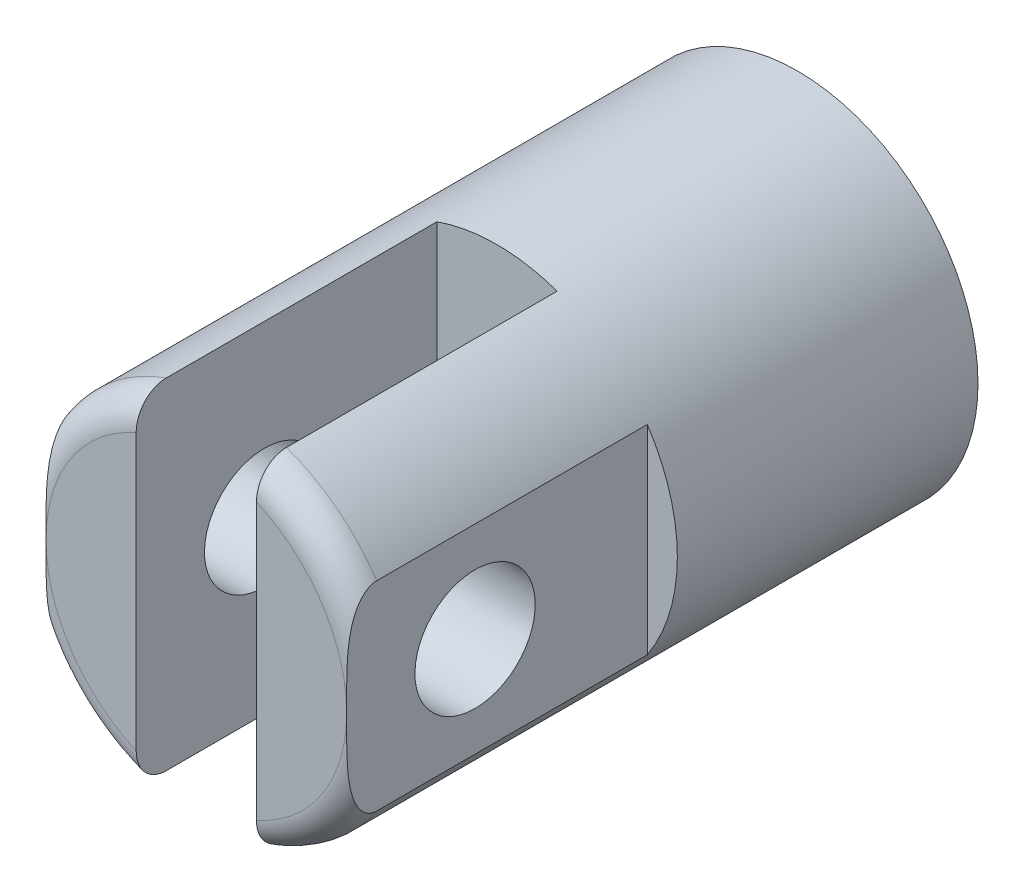
from build123d import *

# Parameters (mm, degrees)
SKETCH_1_R          = 6
SKETCH_1_R_2        = 2
EXTRUDE_1_DEPTH     = 10
EXTRUDE_2_DEPTH     = 10
SKETCH_3_R          = 2
CUT_EXTRUDE_3_DEPTH = 24.600847442
FILLET_1_R          = 1


with BuildPart() as part:
    # Эскиз1 → Вытянуть1 (new body)
    with BuildSketch(Plane.XY):
        Circle(SKETCH_1_R)
        Circle(SKETCH_1_R_2, mode=Mode.SUBTRACT)
    extrude(amount=EXTRUDE_1_DEPTH)

    # Эскиз2 → Вытянуть2 (add)
    with BuildSketch(Plane.XY.offset(10)):
        with BuildLine():
            Line((-5, 3.31662479), (-5, -3.31662479))
            ThreePointArc((-5, -3.31662479), (-3.69041576, -4.730838353), (-2, -5.656854249))
            Line((-2, -5.656854249), (-2, 5.656854249))
            ThreePointArc((-2, 5.656854249), (-3.69041576, 4.730838353), (-5, 3.31662479))
        make_face()
        with BuildLine():
            Line((2, 5.656854249), (2, -5.656854249))
            ThreePointArc((2, -5.656854249), (3.69041576, -4.730838353), (5, -3.31662479))
            Line((5, -3.31662479), (5, 3.31662479))
            ThreePointArc((5, 3.31662479), (3.69041576, 4.730838353), (2, 5.656854249))
        make_face()
    extrude(amount=EXTRUDE_2_DEPTH)

    # Эскиз3 → Вытянуть3 (cut, through all)
    with BuildSketch(Plane.ZY.offset(5)):
        with Locations(Location((15.728074635, 0, 0), (0, 0, 270))):
            Circle(SKETCH_3_R)
    extrude(amount=-CUT_EXTRUDE_3_DEPTH, mode=Mode.SUBTRACT)

    # Скругление1
    fillet_1_edges = [part.edges().sort_by_distance(p)[0] for p in [
        (-3.69041576, 4.730838353, 20),
        (-3.69041576, -4.730838353, 20),
        (3.69041576, -4.730838353, 20),
        (3.69041576, 4.730838353, 20),
    ]]
    fillet(fillet_1_edges, radius=FILLET_1_R - 0.0001)  # a hair under: the kernel refuses the full size


solid = part.part
